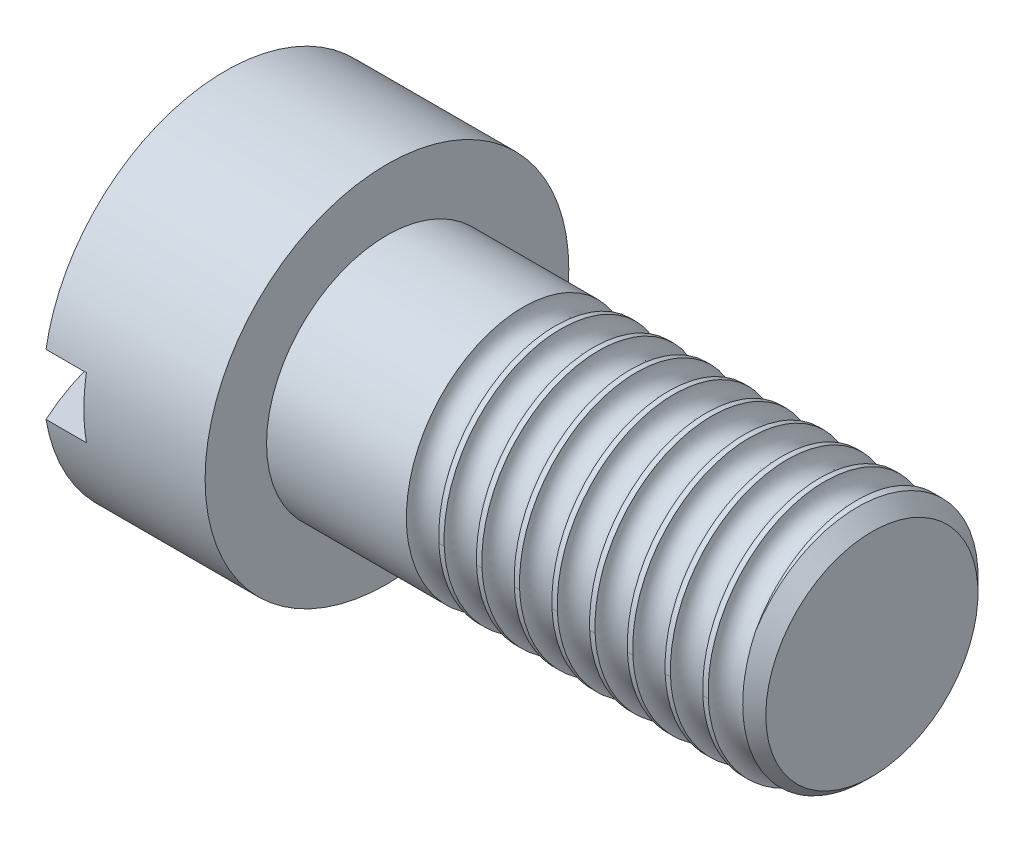
from build123d import *

# Parameters (mm, degrees)
DOME2_FACE_RADIUS  = 7.14375
DOME2_HEIGHT       = 1.5875
SKETCH3_W          = 19.523655442
SKETCH3_H          = 2.38125
CUT_EXTRUDE1_DEPTH = 3.175
CUT_SWEEP1_PITCH   = 1.48172043


with BuildPart() as part:
    # Sketch2 → Revolve1 (revolve)
    with BuildSketch(Plane.XY, mode=Mode.PRIVATE) as revolve1_sk:
        Polygon((-0.567405667, 0), (-0.567405667, 7.14375), (5.782594333, 7.14375), (5.782594333, 4.729311442), (24.271328325, 4.729311442), (24.832594333, 4.168045435), (24.832594333, 0), (0, 0), align=None)
    revolve(revolve1_sk.sketch.rotate(Axis((-24.66214048, 0, 0), (1, 0, 0)), 90), axis=Axis((-24.66214048, 0, 0), (1, 0, 0)))

    # Dome2: a dome of height H over a round flat face of radius A is a cap of a sphere of radius (A * A + H * H) / (2 * H)
    dome2_r = (DOME2_FACE_RADIUS * DOME2_FACE_RADIUS + DOME2_HEIGHT * DOME2_HEIGHT) / (2 * DOME2_HEIGHT)
    dome2_base = Plane((-0.567405667, 0, 0), z_dir=(-1, 0, 0))
    with Locations(dome2_base.offset(DOME2_HEIGHT - dome2_r)):
        dome2_ball = Sphere(dome2_r, mode=Mode.PRIVATE)
    add(split(dome2_ball, bisect_by=dome2_base, keep=Keep.TOP, mode=Mode.PRIVATE))

    # Sketch3 → Cut-Extrude1 (cut)
    with BuildSketch(Plane(origin=(-2.154905667, 0, 0), x_dir=(0, 0, -1), z_dir=(1, 0, 0))):
        Rectangle(SKETCH3_W, SKETCH3_H)
    extrude(amount=CUT_EXTRUDE1_DEPTH, mode=Mode.SUBTRACT)

    # Cut-Sweep1: the profile of Cut-Sweep1 profile screwed along a right-hand helix of 9.25 turns, 8 arcs to a turn; built about Z, then put on its axis
    cut_sweep1_z = Axis((0, 0, 0), (0, 0, 1))
    cut_sweep1_corners = [(4.1275, 0, 0), (4.7625, -0.031404607, 0.63422295), (5.3975, 0, 0), (4.7625, 0.031404607, -0.63422295)]
    with BuildLine(mode=Mode.PRIVATE) as cut_sweep1_profile:
        ThreePointArc((4.1275, 0, 0), (4.313487194, -0.022206411, 0.448463349), (4.7625, -0.031404607, 0.63422295))
        ThreePointArc((4.7625, -0.031404607, 0.63422295), (5.211512806, -0.022206411, 0.448463349), (5.3975, 0, 0))
        ThreePointArc((5.3975, 0, 0), (5.211512806, 0.022206411, -0.448463349), (4.7625, 0.031404607, -0.63422295))
        ThreePointArc((4.7625, 0.031404607, -0.63422295), (4.313487194, 0.022206411, -0.448463349), (4.1275, 0, 0))
    cut_sweep1_cap = Face(cut_sweep1_profile.wire())
    cut_sweep1_arcs = [((4.1275, 0, 0), (4.1275, -0.031404607, 0.63422295), (4.7625, -0.031404607, 0.63422295), (1, 0.7071067811865476, 1)), ((4.7625, -0.031404607, 0.63422295), (5.3975, -0.031404607, 0.63422295), (5.3975, 0, 0), (1, 0.7071067811865476, 1)), ((5.3975, 0, 0), (5.3975, 0.031404607, -0.63422295), (4.7625, 0.031404607, -0.63422295), (1, 0.7071067811865476, 1)), ((4.7625, 0.031404607, -0.63422295), (4.1275, 0.031404607, -0.63422295), (4.1275, 0, 0), (1, 0.7071067811865476, 1))]  # start, shoulder, end, weights
    cut_sweep1_turn_angles = [0, 22.5, 45, 67.5, 90, 112.5, 135, 157.5, 180, 202.5, 225, 247.5, 270, 292.5, 315, 337.5, 360]
    cut_sweep1_turn_weights = [1, 0.9238795325112867, 1, 0.9238795325112867, 1, 0.9238795325112867, 1, 0.9238795325112867, 1, 0.9238795325112867, 1, 0.9238795325112867, 1, 0.9238795325112867, 1, 0.9238795325112867, 1]
    cut_sweep1_turn_sides = [Face.make_bezier_surface([[Vector(p[j][0], p[j][1], 0).rotate(cut_sweep1_z, cut_sweep1_turn_angles[2 * i + k]) / cut_sweep1_turn_weights[2 * i + k] + Vector(0, 0, p[j][2] + CUT_SWEEP1_PITCH * cut_sweep1_turn_angles[2 * i + k] / 360) for k in range(3)] for j in range(3)], [[p[3][j] * cut_sweep1_turn_weights[2 * i + k] for k in range(3)] for j in range(3)]) for p in cut_sweep1_arcs for i in range(8)]
    cut_sweep1_last_angles = [3240, 3262.5, 3285, 3307.5, 3330]
    cut_sweep1_last_weights = [1, 0.9238795325112867, 1, 0.9238795325112428, 1]
    cut_sweep1_last_sides = [Face.make_bezier_surface([[Vector(p[j][0], p[j][1], 0).rotate(cut_sweep1_z, cut_sweep1_last_angles[2 * i + k]) / cut_sweep1_last_weights[2 * i + k] + Vector(0, 0, p[j][2] + CUT_SWEEP1_PITCH * cut_sweep1_last_angles[2 * i + k] / 360) for k in range(3)] for j in range(3)], [[p[3][j] * cut_sweep1_last_weights[2 * i + k] for k in range(3)] for j in range(3)]) for p in cut_sweep1_arcs for i in range(2)]
    cut_sweep1 = Plane(origin=(24.324594333, 0, 0), x_dir=(0, -0.7071067811865389, -0.7071067811865561), z_dir=(-1, 0, 0)) * Solid(Shell([*[p.moved(Location((0, 0, CUT_SWEEP1_PITCH * i))) for i in range(9) for p in cut_sweep1_turn_sides], *cut_sweep1_last_sides, cut_sweep1_cap, cut_sweep1_cap.rotate(cut_sweep1_z, 3330).moved(Location((0, 0, CUT_SWEEP1_PITCH * 3330 / 360)))]))
    add(cut_sweep1, mode=Mode.SUBTRACT)


solid = part.part
